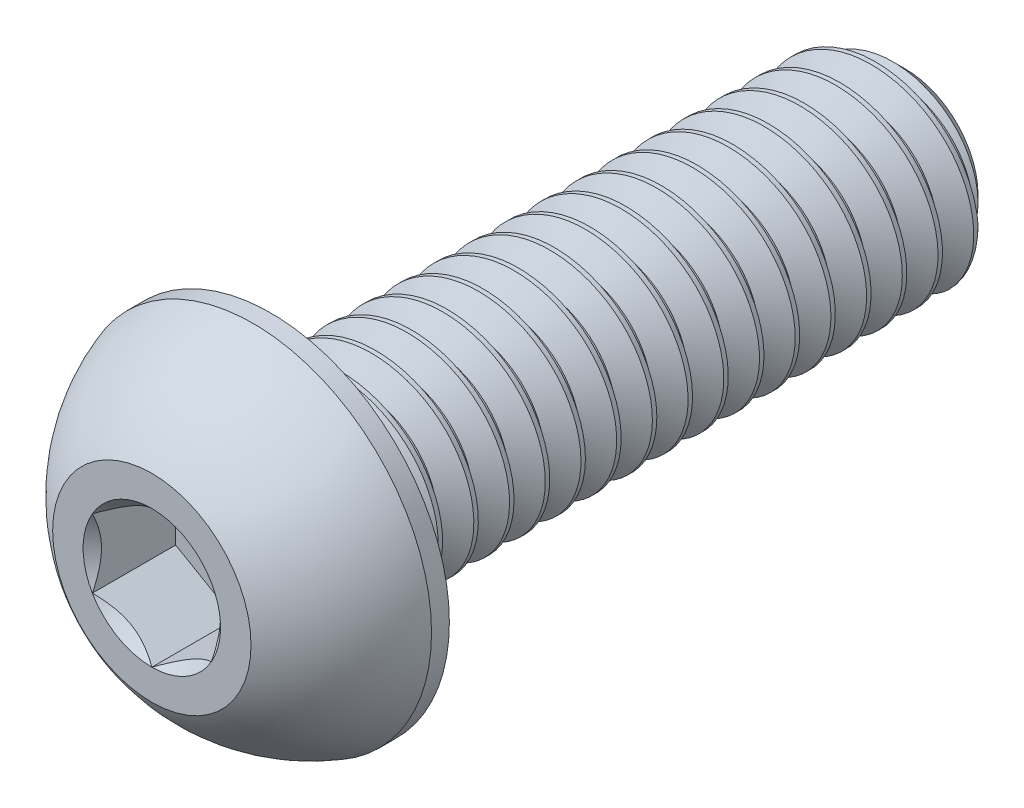
from build123d import *

# Parameters (mm, degrees)
CUT_EXTRUDE2_DEPTH = 1.05
CUT_SWEEP2_PITCH   = 0.45


# Read off the part's stored shape, not the designer's step: Split1, Boss-Extrude1
with BuildPart() as part:
    # Sketch10 → Revolve3 (revolve)
    with BuildSketch(Plane(origin=(0, 0, 0), x_dir=(0, 0, -1), z_dir=(1, 0, 0)), mode=Mode.PRIVATE) as revolve3_sk:
        Polygon((9.1625, 1.25), (9.5, 0.9125), (9.5, 0), (1.5, 0), (1.5, 1.25), align=None)
    revolve(revolve3_sk.sketch.rotate(Axis((0, 0, 0), (0, 0, -1)), 90), axis=Axis((0, 0, 0), (0, 0, -1)))

    # Sketch7 → Revolve2 (revolve)
    with BuildSketch(Plane(origin=(0, 0, 0), x_dir=(0, 0, -1), z_dir=(1, 0, 0)), mode=Mode.PRIVATE) as revolve2_sk:
        with BuildLine():
            Line((1.275, 2.25), (1.5, 2.25))
            Line((1.5, 2.25), (1.5, 0))
            Line((1.5, 0), (0, 0))
            Line((0, 0), (0, 1.25))
            ThreePointArc((0, 1.25), (0.549264706, 1.8625), (1.275, 2.25))
        make_face()
    revolve(revolve2_sk.sketch.rotate(Axis((0, 0, 0), (0, 0, -1)), 180), axis=Axis((0, 0, 0), (0, 0, -1)))

    # Sketch5 → Cut-Extrude2 (cut)
    with BuildSketch(Plane.XY):
        Polygon((0.75, -0.433012702), (0.75, 0.433012702), (0, 0.866025404), (-0.75, 0.433012702), (-0.75, -0.433012702), (0, -0.866025404), align=None)
    extrude(amount=-CUT_EXTRUDE2_DEPTH, mode=Mode.SUBTRACT)

    # Cut-Extrude3 cone 1 section (through the dimple's axis) → Cut-Extrude3 (revolve, cut)
    with BuildSketch(Plane(origin=(0, 0, 0), x_dir=(0, -1, 0), z_dir=(1, 0, 0))):
        Polygon((0, 0), (0.866025404, 0), (0, 0.866025404), align=None)
    revolve(axis=Axis((0, 0, 0), (0, 0, -1)), mode=Mode.SUBTRACT)


with BuildPart() as body_2:
    # Split1: the piece on the far side of the plane
    add(part.part)
    split(bisect_by=Plane.XY.offset(-1.5), keep=Keep.BOTTOM)

    # Cut-Sweep2: the profile of Sketch12 screwed along a right-hand helix of 21.111111 turns, 6 arcs to a turn; built about Z, then put on its axis
    cut_sweep2_z = Axis((0, 0, 0), (0, 0, 1))
    cut_sweep2_corners = [(0.957716426, 0, -0.16875), (0.957716426, 0, -0.225), (1.274356964, 0, -0.4078125), (1.274356964, 0, 0.0140625)]
    with BuildLine(mode=Mode.PRIVATE) as cut_sweep2_profile:
        Line(cut_sweep2_corners[0], cut_sweep2_corners[1])
        Line(cut_sweep2_corners[1], cut_sweep2_corners[2])
        Line(cut_sweep2_corners[2], cut_sweep2_corners[3])
        Line(cut_sweep2_corners[3], cut_sweep2_corners[0])
    cut_sweep2_cap = Face(cut_sweep2_profile.wire())
    cut_sweep2_turn_angles = [0, 30, 60, 90, 120, 150, 180, 210, 240, 270, 300, 330, 360]
    cut_sweep2_turn_weights = [1, 0.8660254037844387, 1, 0.8660254037844387, 1, 0.8660254037844387, 1, 0.8660254037844387, 1, 0.8660254037844387, 1, 0.8660254037844387, 1]
    cut_sweep2_turn_rails = [Edge.make_bspline([Vector(p[0], p[1], 0).rotate(cut_sweep2_z, cut_sweep2_turn_angles[k]) / cut_sweep2_turn_weights[k] + Vector(0, 0, p[2] + CUT_SWEEP2_PITCH * cut_sweep2_turn_angles[k] / 360) for k in range(13)], [0, 0, 0, 1, 1, 2, 2, 3, 3, 4, 4, 5, 5, 6, 6, 6], 2, cut_sweep2_turn_weights) for p in cut_sweep2_corners]
    cut_sweep2_turn_sides = [Face.make_surface_from_curves(cut_sweep2_turn_rails[p[0]], cut_sweep2_turn_rails[p[1]]) for p in [(0, 1), (1, 2), (2, 3), (3, 0)]]
    cut_sweep2_turn = Solid(Shell([*cut_sweep2_turn_sides, cut_sweep2_cap, cut_sweep2_cap.rotate(cut_sweep2_z, 360).moved(Location((0, 0, CUT_SWEEP2_PITCH * 360 / 360)))]))
    cut_sweep2_last_angles = [7560, 7580, 7600]
    cut_sweep2_last_weights = [1, 0.9396926207858867, 1]
    cut_sweep2_last_rails = [Edge.make_bspline([Vector(p[0], p[1], 0).rotate(cut_sweep2_z, cut_sweep2_last_angles[k]) / cut_sweep2_last_weights[k] + Vector(0, 0, p[2] + CUT_SWEEP2_PITCH * cut_sweep2_last_angles[k] / 360) for k in range(3)], [0, 0, 0, 1, 1, 1], 2, cut_sweep2_last_weights) for p in cut_sweep2_corners]
    cut_sweep2_last_sides = [Face.make_surface_from_curves(cut_sweep2_last_rails[p[0]], cut_sweep2_last_rails[p[1]]) for p in [(0, 1), (1, 2), (2, 3), (3, 0)]]
    cut_sweep2_last = Solid(Shell([*cut_sweep2_last_sides, cut_sweep2_cap.rotate(cut_sweep2_z, 7560).moved(Location((0, 0, CUT_SWEEP2_PITCH * 7560 / 360))), cut_sweep2_cap.rotate(cut_sweep2_z, 7600).moved(Location((0, 0, CUT_SWEEP2_PITCH * 7600 / 360)))]))
    cut_sweep2_each = [*[cut_sweep2_turn.moved(Location((0, 0, CUT_SWEEP2_PITCH * i))) for i in range(21)], cut_sweep2_last]
    add(Plane(origin=(0, 0, -9.5), x_dir=(0, 1, 0), z_dir=(0, 0, 1)) * Compound([cut_sweep2_each[i] for i in range(0, 22, 2)]), mode=Mode.SUBTRACT)
    add(Plane(origin=(0, 0, -9.5), x_dir=(0, 1, 0), z_dir=(0, 0, 1)) * Compound([cut_sweep2_each[i] for i in range(1, 22, 2)]), mode=Mode.SUBTRACT)


with BuildPart() as part_1:
    add(part.part)

    # Split1
    split(bisect_by=Plane.XY.offset(-1.5), keep=Keep.TOP)

    add(body_2.part)  # Boss-Extrude1 merges body 2
    # Boss-Extrude1 outline → Boss-Extrude1 (revolve)
    with BuildSketch(Plane.XZ):
        Polygon((0.957716426, -1.5), (0.957716426, -1.792283574), (1.25, -1.5), align=None)
    revolve(axis=Axis((0, 0, 0), (0, 0, 1)))


solid = part_1.part
